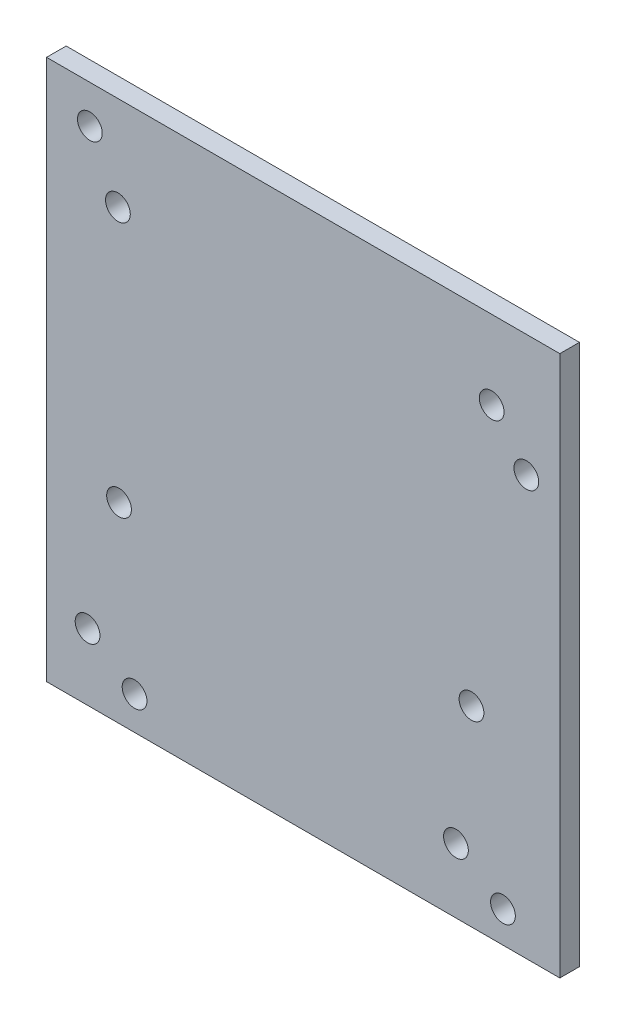
from build123d import *

# Parameters (mm, degrees)
SKETCH1_W           = 166.44628819
SKETCH1_H           = 175.350054565
SKETCH1_R           = 4.0127
SKETCH1_R_2         = 4.0132
BOSS_EXTRUDE1_DEPTH = 6.35


with BuildPart() as part:
    # Sketch1 → Boss-Extrude1 (new body)
    with BuildSketch(Plane.XY):
        with Locations((-612.934360792, 295.578292869)):
            Rectangle(SKETCH1_W, SKETCH1_H)
        with Locations((-667.625800723, 218.698265586)):
            Circle(SKETCH1_R, mode=Mode.SUBTRACT)
        with Locations((-682.865800723, 229.493265586)):
            Circle(SKETCH1_R, mode=Mode.SUBTRACT)
        with Locations((-682.121778024, 370.932816424)):
            Circle(SKETCH1_R, mode=Mode.SUBTRACT)
        with Locations((-673.025414388, 352.751458015)):
            Circle(SKETCH1_R, mode=Mode.SUBTRACT)
        with Locations((-551.816021726, 357.766762234)):
            Circle(SKETCH1_R, mode=Mode.SUBTRACT)
        with Locations((-540.572963718, 343.760561942)):
            Circle(SKETCH1_R, mode=Mode.SUBTRACT)
        with Locations((-548.15692674, 218.063265586)):
            Circle(SKETCH1_R, mode=Mode.SUBTRACT)
        with Locations((-563.39692674, 228.858265586)):
            Circle(SKETCH1_R, mode=Mode.SUBTRACT)
        with Locations((-558.361573731, 269.972580351)):
            Circle(SKETCH1_R_2, mode=Mode.SUBTRACT)
        with Locations((-672.661153731, 269.972580351)):
            Circle(SKETCH1_R_2, mode=Mode.SUBTRACT)
    extrude(amount=BOSS_EXTRUDE1_DEPTH)


solid = part.part
